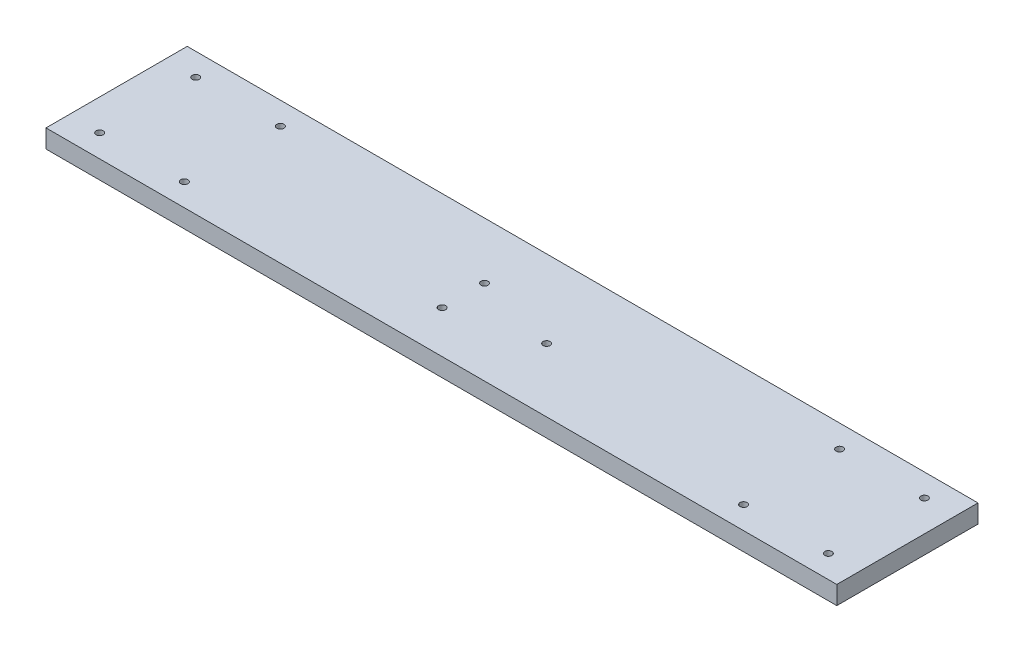
from build123d import *

# Parameters (mm, degrees)
SKETCH1_W           = 280
SKETCH1_H           = 50
BOSS_EXTRUDE1_DEPTH = 6.5
SKETCH2_R           = 1.25
CUT_EXTRUDE1_DEPTH  = 285.503514917


with BuildPart() as part:
    # Sketch1 → Boss-Extrude1 (new body)
    with BuildSketch(Plane(origin=(0, 0, 0), x_dir=(1, 0, 0), z_dir=(0, 1, 0))):
        with Locations((140, 25)):
            Rectangle(SKETCH1_W, SKETCH1_H)
    extrude(amount=BOSS_EXTRUDE1_DEPTH)

    # Sketch2 → Cut-Extrude1 (cut, through all)
    with BuildSketch(Plane(origin=(0, 0, 0), x_dir=(-1, 0, 0), z_dir=(0, -1, 0))):
        with Locations((-239, 42)):
            Circle(SKETCH2_R)
        with Locations((-239, 8)):
            Circle(SKETCH2_R)
        with Locations((-269, 8)):
            Circle(SKETCH2_R)
        with Locations((-269, 42)):
            Circle(SKETCH2_R)
        with Locations((-41, 42)):
            Circle(SKETCH2_R)
        with Locations((-11, 42)):
            Circle(SKETCH2_R)
        with Locations((-41, 8)):
            Circle(SKETCH2_R)
        with Locations((-11, 8)):
            Circle(SKETCH2_R)
        with Locations((-125.25, 30)):
            Circle(SKETCH2_R)
        with Locations((-125.25, 15)):
            Circle(SKETCH2_R)
        with Locations((-154.75, 22.5)):
            Circle(SKETCH2_R)
    extrude(amount=-CUT_EXTRUDE1_DEPTH, mode=Mode.SUBTRACT)


solid = part.part
